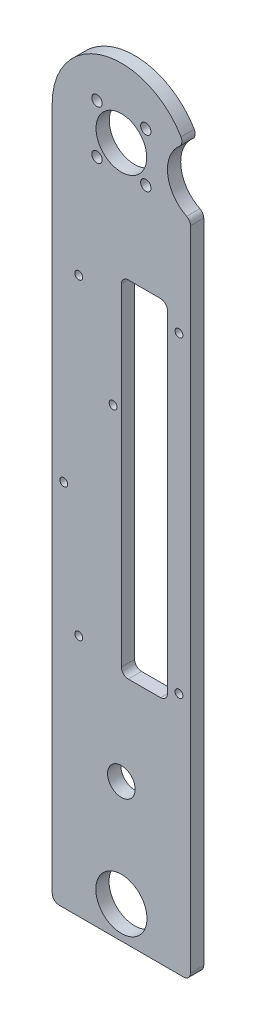
from build123d import *

# Parameters (mm, degrees)
SKETCH1_W              = 5.75
SKETCH1_H              = 330
BOSS_EXTRUDE1_DEPTH    = 60
CUT_EXTRUDE1_START     = -5.75
CUT_EXTRUDE1_OUTLINE_R = 11
CUT_EXTRUDE1_DEPTH     = 5.75
M4_CLEARANCE_HOLE1_D   = 4.5
SKETCH10_R             = 11.1125
CUT_EXTRUDE4_DEPTH     = 5.75
SKETCH13_R             = 6
SKETCH13_W             = 20
SKETCH13_H             = 150
CUT_EXTRUDE5_DEPTH     = 5.75
FILLET2_R              = 3
M3_CLEARANCE_HOLE1_D   = 3.4


# Read off the part's stored shape, not the designer's step: Cut-Extrude1
with BuildPart() as part:
    # Sketch1 → Boss-Extrude1 (new body)
    with BuildSketch(Plane(origin=(0, 0, 0), x_dir=(0, 0, -1), z_dir=(1, 0, 0))):
        with Locations((-2.875, 165)):
            Rectangle(SKETCH1_W, SKETCH1_H)
    extrude(amount=BOSS_EXTRUDE1_DEPTH)

    # Cut-Extrude1 outline → Cut-Extrude1 (cut)
    with BuildSketch(Plane.XY.offset(5.75).offset(CUT_EXTRUDE1_START)):
        with BuildLine():
            ThreePointArc((0, 300), (8.786796564, 321.213203436), (30, 330))
            Line((30, 330), (0, 330))
            Line((0, 330), (0, 300))
        make_face()
        with BuildLine():
            ThreePointArc((30, 330), (51.213203436, 321.213203436), (60, 300))
            Line((60, 300), (60, 330))
            Line((60, 330), (30, 330))
        make_face()
        with Locations((30, 300)):
            Circle(CUT_EXTRUDE1_OUTLINE_R)
    extrude(amount=CUT_EXTRUDE1_DEPTH, mode=Mode.SUBTRACT)

    # M4 Clearance Hole1 (through all)
    with Locations(Plane.XY.offset(5.75)):
        with Locations((19.393398282, 310.606601718), (40.606601718, 310.606601718), (40.606601718, 289.393398282), (19.393398282, 289.393398282)):
            Hole(M4_CLEARANCE_HOLE1_D / 2)

    # Sketch10 → Cut-Extrude4 (cut)
    with BuildSketch(Plane(origin=(0, 0, 0), x_dir=(-1, 0, 0), z_dir=(0, 0, -1))):
        with Locations(Location((-30, 14, 0), (0, 0, 90))):
            Circle(SKETCH10_R)
    extrude(amount=-CUT_EXTRUDE4_DEPTH, mode=Mode.SUBTRACT)

    # Sketch13 → Cut-Extrude5 (cut)
    with BuildSketch(Plane(origin=(0, 0, 0), x_dir=(-1, 0, 0), z_dir=(0, 0, -1))):
        with Locations(Location((-30, 60, 0), (0, 0, 90))):
            Circle(SKETCH13_R)
        with Locations((-40, 175)):
            Rectangle(SKETCH13_W, SKETCH13_H)
        with BuildLine():
            Line((-60, 285.857864376), (-60, 300))
            ThreePointArc((-60, 300), (-59.277002188, 306.546536707), (-57.142857143, 312.7775313))
            ThreePointArc((-57.142857143, 312.7775313), (-50.08377905, 298.416853586), (-60, 285.857864376))
        make_face()
    extrude(amount=-CUT_EXTRUDE5_DEPTH, mode=Mode.SUBTRACT)

    # Fillet2
    fillet2_edges = [part.edges().sort_by_distance(p)[0] for p in [
        (60, 0, 2.875),
        (0, 0, 2.875),
        (57.142857143, 312.7775313, 2.875),
        (60, 285.857864376, 2.875),
        (50, 100, 2.875),
        (50, 250, 2.875),
        (30, 250, 2.875),
        (30, 100, 2.875),
    ]]
    fillet(fillet2_edges, radius=FILLET2_R)

    # M3 Clearance Hole1 (through all)
    with Locations(Plane(origin=(0, 0, 0), x_dir=(-1, 0, 0), z_dir=(0, 0, -1))):
        with Locations((-11.50000102, 240.99999992), (-55.00000038, 240.99999992), (-11.50000102, 105.49999914), (-55.00000038, 105.49999914), (-5, 160), (-26.4, 199.7)):
            Hole(M3_CLEARANCE_HOLE1_D / 2)


solid = part.part
